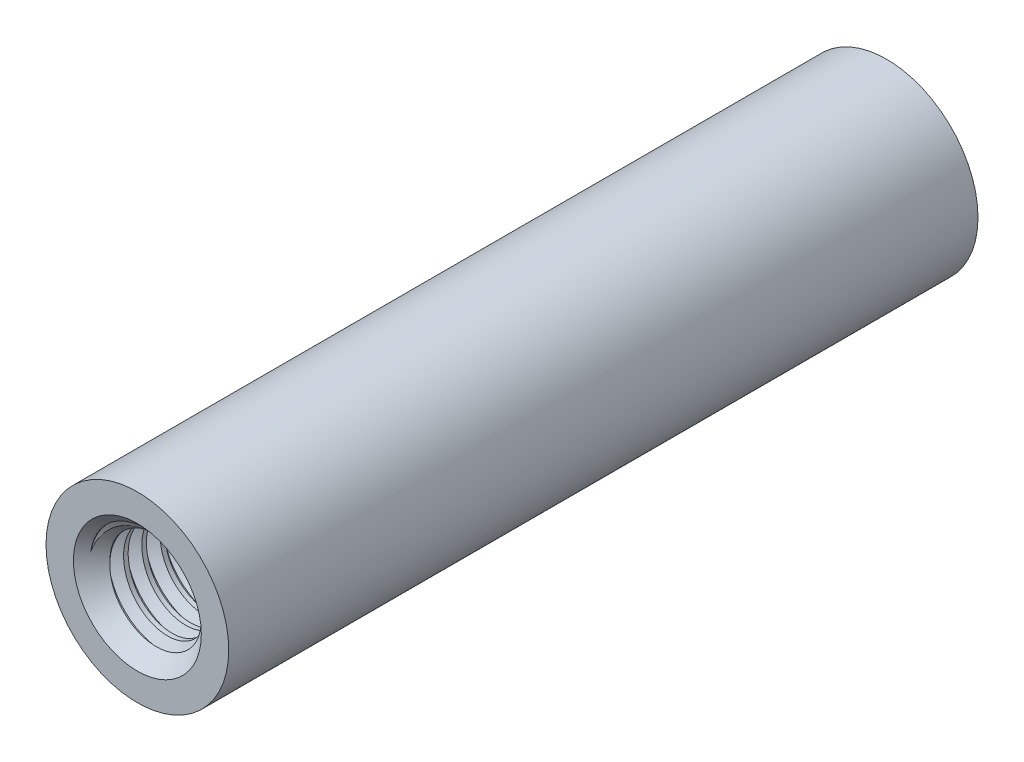
from build123d import *

# Parameters (mm, degrees)
CHAMFER2_SIZE            = 1
THREAD2_PITCH            = 1
CHAMFER2_OF_MIRROR2_SIZE = 1
THREAD3_PITCH            = 1


with BuildPart() as part:
    # Sketch1 → Revolve1 (revolve)
    with BuildSketch(Plane(origin=(0, 0, 0), x_dir=(1, 0, 0), z_dir=(0, 1, 0))):
        Polygon((2.5, 8.5), (2.5, 20.5), (5, 20.5), (5, 0), (0, 0), (0, 6.5), align=None)
    revolve1 = revolve(axis=Axis((0, 0, 292.855059188), (0, 0, -1)))

    # Chamfer2
    chamfer2_edges = [part.edges().sort_by_distance(p)[0] for p in [
        (-2.5, 0, -20.5),
    ]]
    chamfer(chamfer2_edges, length=CHAMFER2_SIZE)

    # Thread2: the profile of Thread Profile2 profile screwed along a right-hand helix of 13 turns, 8 arcs to a turn; built about Z, then put on its axis
    thread2_z = Axis((0, 0, 0), (0, 0, 1))
    thread2_corners = [(2.4997, 0, -0.000173205), (3.041265875, 0, 0.312499999), (3.041265875, 0, 0.437499999), (2.4997, 0, 0.750173202)]
    with BuildLine(mode=Mode.PRIVATE) as thread2_profile:
        Line(thread2_corners[0], thread2_corners[1])
        Line(thread2_corners[1], thread2_corners[2])
        Line(thread2_corners[2], thread2_corners[3])
        Line(thread2_corners[3], thread2_corners[0])
    thread2_cap = Face(thread2_profile.wire())
    thread2_turn_angles = [0, 22.5, 45, 67.5, 90, 112.5, 135, 157.5, 180, 202.5, 225, 247.5, 270, 292.5, 315, 337.5, 360]
    thread2_turn_weights = [1, 0.9238795325112867, 1, 0.9238795325112867, 1, 0.9238795325112867, 1, 0.9238795325112867, 1, 0.9238795325112867, 1, 0.9238795325112867, 1, 0.9238795325112867, 1, 0.9238795325112867, 1]
    thread2_turn_rails = [Edge.make_bspline([Vector(p[0], p[1], 0).rotate(thread2_z, thread2_turn_angles[k]) / thread2_turn_weights[k] + Vector(0, 0, p[2] + THREAD2_PITCH * thread2_turn_angles[k] / 360) for k in range(17)], [0, 0, 0, 1, 1, 2, 2, 3, 3, 4, 4, 5, 5, 6, 6, 7, 7, 8, 8, 8], 2, thread2_turn_weights) for p in thread2_corners]
    thread2_turn_sides = [Face.make_surface_from_curves(thread2_turn_rails[p[0]], thread2_turn_rails[p[1]]) for p in [(0, 1), (1, 2), (2, 3), (3, 0)]]
    thread2 = Plane(origin=(0, 0, -21.5), x_dir=(1, 0, 0), z_dir=(0, 0, 1)) * Solid(Shell([*[p.moved(Location((0, 0, THREAD2_PITCH * i))) for i in range(13) for p in thread2_turn_sides], thread2_cap, thread2_cap.rotate(thread2_z, 4680).moved(Location((0, 0, THREAD2_PITCH * 4680 / 360)))]))
    add(thread2, mode=Mode.SUBTRACT)

    # Mirror2: Revolve1 across plane
    add(revolve1.mirror(Plane(origin=(5, 0, 0), x_dir=(1, 0, 0), z_dir=(0, 0, 1))))

    # Chamfer2 of Mirror2
    chamfer2_of_mirror2_edges = [part.edges().sort_by_distance(p)[0] for p in [
        (-2.5, 0, 20.5),
    ]]
    chamfer(chamfer2_of_mirror2_edges, length=CHAMFER2_OF_MIRROR2_SIZE)

    # Thread3: the profile of Thread Profile3 profile screwed along a right-hand helix of 13 turns, 8 arcs to a turn; built about Z, then put on its axis
    thread3_z = Axis((0, 0, 0), (0, 0, 1))
    thread3_corners = [(2.4997, 0, -0.000173205), (3.041265875, 0, 0.312499999), (3.041265875, 0, 0.437499999), (2.4997, 0, 0.750173202)]
    with BuildLine(mode=Mode.PRIVATE) as thread3_profile:
        Line(thread3_corners[0], thread3_corners[1])
        Line(thread3_corners[1], thread3_corners[2])
        Line(thread3_corners[2], thread3_corners[3])
        Line(thread3_corners[3], thread3_corners[0])
    thread3_cap = Face(thread3_profile.wire())
    thread3_turn_angles = [0, 22.5, 45, 67.5, 90, 112.5, 135, 157.5, 180, 202.5, 225, 247.5, 270, 292.5, 315, 337.5, 360]
    thread3_turn_weights = [1, 0.9238795325112867, 1, 0.9238795325112867, 1, 0.9238795325112867, 1, 0.9238795325112867, 1, 0.9238795325112867, 1, 0.9238795325112867, 1, 0.9238795325112867, 1, 0.9238795325112867, 1]
    thread3_turn_rails = [Edge.make_bspline([Vector(p[0], p[1], 0).rotate(thread3_z, thread3_turn_angles[k]) / thread3_turn_weights[k] + Vector(0, 0, p[2] + THREAD3_PITCH * thread3_turn_angles[k] / 360) for k in range(17)], [0, 0, 0, 1, 1, 2, 2, 3, 3, 4, 4, 5, 5, 6, 6, 7, 7, 8, 8, 8], 2, thread3_turn_weights) for p in thread3_corners]
    thread3_turn_sides = [Face.make_surface_from_curves(thread3_turn_rails[p[0]], thread3_turn_rails[p[1]]) for p in [(0, 1), (1, 2), (2, 3), (3, 0)]]
    thread3 = Plane(origin=(0, 0, 21.5), x_dir=(-1, 0, 0), z_dir=(0, 0, -1)) * Solid(Shell([*[p.moved(Location((0, 0, THREAD3_PITCH * i))) for i in range(13) for p in thread3_turn_sides], thread3_cap, thread3_cap.rotate(thread3_z, 4680).moved(Location((0, 0, THREAD3_PITCH * 4680 / 360)))]))
    add(thread3, mode=Mode.SUBTRACT)


solid = part.part
